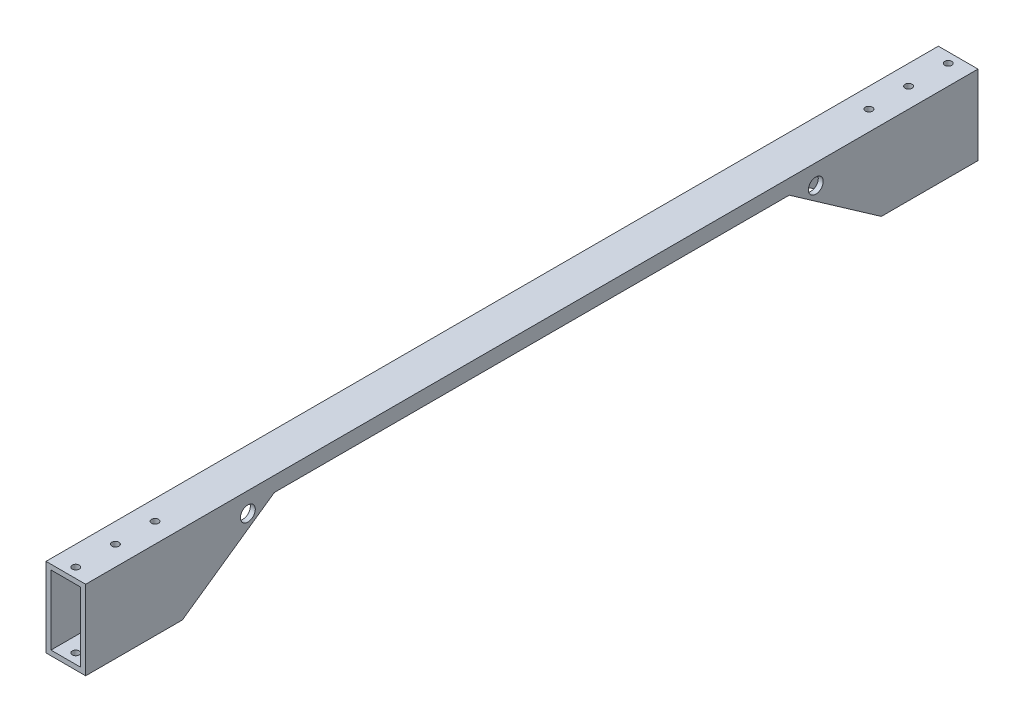
from build123d import *

# Parameters (mm, degrees)
SKETCH1_W                    = 25.4
SKETCH1_H                    = 50.8
SKETCH1_W_2                  = 19.05
SKETCH1_H_2                  = 44.45
EXTRUDE_THIN1_DEPTH          = 571.5
F_8_CLEARANCE_HOLE1_D        = 4.4958
CUT_EXTRUDE1_DEPTH           = 573.627776134
F_3_8_0_375_DIAMETER_HOLE1_D = 9.525


with BuildPart() as part:
    # Sketch1 → Extrude-Thin1 (new body)
    with BuildSketch(Plane.XY):
        Rectangle(SKETCH1_W, SKETCH1_H)
        Rectangle(SKETCH1_W_2, SKETCH1_H_2, mode=Mode.SUBTRACT)
    extrude(amount=EXTRUDE_THIN1_DEPTH)

    # #8 Clearance Hole1 (through all)
    with Locations(Plane(origin=(0, 25.4, 565.15), x_dir=(0, 0, 1), z_dir=(0, 1, 0))):
        with Locations((0, 0), (-558.8, 0), (-533.4, 0), (-508, 0), (-25.4, 0), (-50.8, 0)):
            Hole(F_8_CLEARANCE_HOLE1_D / 2)

    # Sketch10 → Cut-Extrude1 (cut, through all)
    with BuildSketch(Plane(origin=(12.7, 0, 0), x_dir=(0, 0, -1), z_dir=(1, 0, 0))):
        Polygon((-509.5875, -25.4), (-450.640691022, 15.875), (-120.859308978, 15.875), (-61.9125, -25.4), align=None)
    extrude(amount=-CUT_EXTRUDE1_DEPTH, mode=Mode.SUBTRACT)

    # 3/8 (0.375) Diameter Hole1 (through all)
    with Locations(Plane(origin=(-12.7, -44.45, 285.75), x_dir=(0, 0, -1), z_dir=(-1, 0, 0))):
        with Locations((-181.864, -86.995), (-169.164, -78.74), (169.164, -78.74), (181.864, -86.995), (181.864, -57.15), (-181.864, -57.15)):
            Hole(F_3_8_0_375_DIAMETER_HOLE1_D / 2)


solid = part.part
